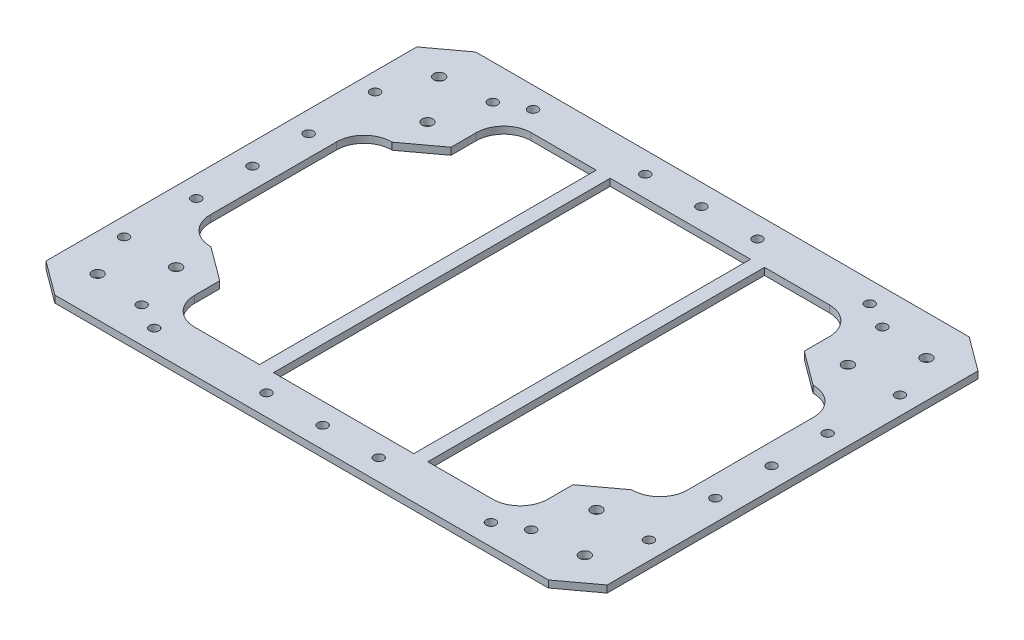
from build123d import *

# Parameters (mm, degrees)
SKETCH1_W           = 63.5
SKETCH1_H           = 152.4
BOSS_EXTRUDE1_DEPTH = 3.175
SKETCH2_R           = 2.4638
SKETCH2_R_2         = 2.159
CUT_EXTRUDE1_DEPTH  = 159.781746826
SKETCH3_R           = 2.159
CUT_EXTRUDE2_DEPTH  = 159.781746826


with BuildPart() as part:
    # Sketch1 → Boss-Extrude1 (new body)
    with BuildSketch(Plane(origin=(0, 0, 0), x_dir=(1, 0, 0), z_dir=(0, 1, 0))):
        Polygon((-111.686526805, 95.25), (-127, 83.918625912), (-127, -83.918625912), (-111.686526805, -95.25), (111.686526805, -95.25), (127, -83.918625912), (127, 83.918625912), (111.686526805, 95.25), align=None)
        with BuildLine():
            Line((-107.95, -28.564963508), (-107.95, 28.564963508))
            ThreePointArc((-107.95, 28.564963508), (-104.304650999, 37.365614506), (-95.504, 41.010963508))
            Line((-95.504, 41.010963508), (-95.25, 41.010963508))
            Line((-95.25, 41.010963508), (-79.936526805, 52.342337595))
            Line((-79.936526805, 52.342337595), (-79.936526805, 63.754))
            ThreePointArc((-79.936526805, 63.754), (-76.291177804, 72.554650999), (-67.490526805, 76.2))
            Line((-67.490526805, 76.2), (-38.1, 76.2))
            Line((-38.1, 76.2), (-38.1, -76.2))
            Line((-38.1, -76.2), (-67.490526805, -76.2))
            ThreePointArc((-67.490526805, -76.2), (-76.291177804, -72.554650999), (-79.936526805, -63.754))
            Line((-79.936526805, -63.754), (-79.936526805, -52.342337595))
            Line((-79.936526805, -52.342337595), (-95.25, -41.010963508))
            Line((-95.25, -41.010963508), (-95.504, -41.010963508))
            ThreePointArc((-95.504, -41.010963508), (-104.304650999, -37.365614506), (-107.95, -28.564963508))
        make_face(mode=Mode.SUBTRACT)
        Rectangle(SKETCH1_W, SKETCH1_H, mode=Mode.SUBTRACT)
        with BuildLine():
            Line((67.490526805, -76.2), (38.1, -76.2))
            Line((38.1, -76.2), (38.1, 76.2))
            Line((38.1, 76.2), (67.490526805, 76.2))
            ThreePointArc((67.490526805, 76.2), (76.291177804, 72.554650999), (79.936526805, 63.754))
            Line((79.936526805, 63.754), (79.936526805, 52.342337595))
            Line((79.936526805, 52.342337595), (95.25, 41.010963508))
            Line((95.25, 41.010963508), (95.504, 41.010963508))
            ThreePointArc((95.504, 41.010963508), (104.304650999, 37.365614506), (107.95, 28.564963508))
            Line((107.95, 28.564963508), (107.95, -28.564963508))
            ThreePointArc((107.95, -28.564963508), (104.304650999, -37.365614506), (95.504, -41.010963508))
            Line((95.504, -41.010963508), (95.25, -41.010963508))
            Line((95.25, -41.010963508), (79.936526805, -52.342337595))
            Line((79.936526805, -52.342337595), (79.936526805, -63.754))
            ThreePointArc((79.936526805, -63.754), (76.291177804, -72.554650999), (67.490526805, -76.2))
        make_face(mode=Mode.SUBTRACT)
    extrude(amount=BOSS_EXTRUDE1_DEPTH)

    # Sketch2 → Cut-Extrude1 (cut, through all)
    with BuildSketch(Plane(origin=(0, 3.175, 0), x_dir=(1, 0, 0), z_dir=(0, 1, 0))):
        with Locations((-95.147512794, 56.885632681)):
            Circle(SKETCH2_R)
        with Locations((-110.256011578, 77.303596941)):
            Circle(SKETCH2_R)
        with Locations((110.256011578, 77.303596941)):
            Circle(SKETCH2_R)
        with Locations((95.147512794, 56.885632681)):
            Circle(SKETCH2_R)
        with Locations((110.256011578, -77.303596941)):
            Circle(SKETCH2_R)
        with Locations((95.147512794, -56.885632681)):
            Circle(SKETCH2_R)
        with Locations((-110.256011578, -77.303596941)):
            Circle(SKETCH2_R)
        with Locations((-95.147512794, -56.885632681)):
            Circle(SKETCH2_R)
        with Locations((-88.154790208, 79.461855841)):
            Circle(SKETCH2_R_2)
        with Locations((-118.781736597, 56.799107666)):
            Circle(SKETCH2_R_2)
        with Locations((118.781736597, 56.799107666)):
            Circle(SKETCH2_R_2)
        with Locations((88.154790208, 79.461855841)):
            Circle(SKETCH2_R_2)
        with Locations((118.781736597, -56.799107666)):
            Circle(SKETCH2_R_2)
        with Locations((88.154790208, -79.461855841)):
            Circle(SKETCH2_R_2)
        with Locations((-88.154790208, -79.461855841)):
            Circle(SKETCH2_R_2)
        with Locations((-118.781736597, -56.799107666)):
            Circle(SKETCH2_R_2)
    extrude(amount=-CUT_EXTRUDE1_DEPTH, mode=Mode.SUBTRACT)

    # Sketch3 → Cut-Extrude2 (cut, through all)
    with BuildSketch(Plane(origin=(0, 3.175, 0), x_dir=(1, 0, 0), z_dir=(0, 1, 0))):
        with Locations((-76.2, 85.725)):
            Circle(SKETCH3_R)
        with Locations((-25.4, 85.725)):
            Circle(SKETCH3_R)
        with Locations((25.4, 85.725)):
            Circle(SKETCH3_R)
        with Locations((76.2, 85.725)):
            Circle(SKETCH3_R)
        with Locations((76.2, -85.725)):
            Circle(SKETCH3_R)
        with Locations((25.4, -85.725)):
            Circle(SKETCH3_R)
        with Locations((-25.4, -85.725)):
            Circle(SKETCH3_R)
        with Locations((-76.2, -85.725)):
            Circle(SKETCH3_R)
        with Locations((-117.475, -25.4)):
            Circle(SKETCH3_R)
        with Locations((-117.475, 25.4)):
            Circle(SKETCH3_R)
        with Locations((117.475, 25.4)):
            Circle(SKETCH3_R)
        with Locations((117.475, -25.4)):
            Circle(SKETCH3_R)
        with Locations((0, 85.725)):
            Circle(SKETCH3_R)
        with Locations((0, -85.725)):
            Circle(SKETCH3_R)
        with Locations((-117.475, 0)):
            Circle(SKETCH3_R)
        with Locations((117.475, 0)):
            Circle(SKETCH3_R)
    extrude(amount=-CUT_EXTRUDE2_DEPTH, mode=Mode.SUBTRACT)


solid = part.part
